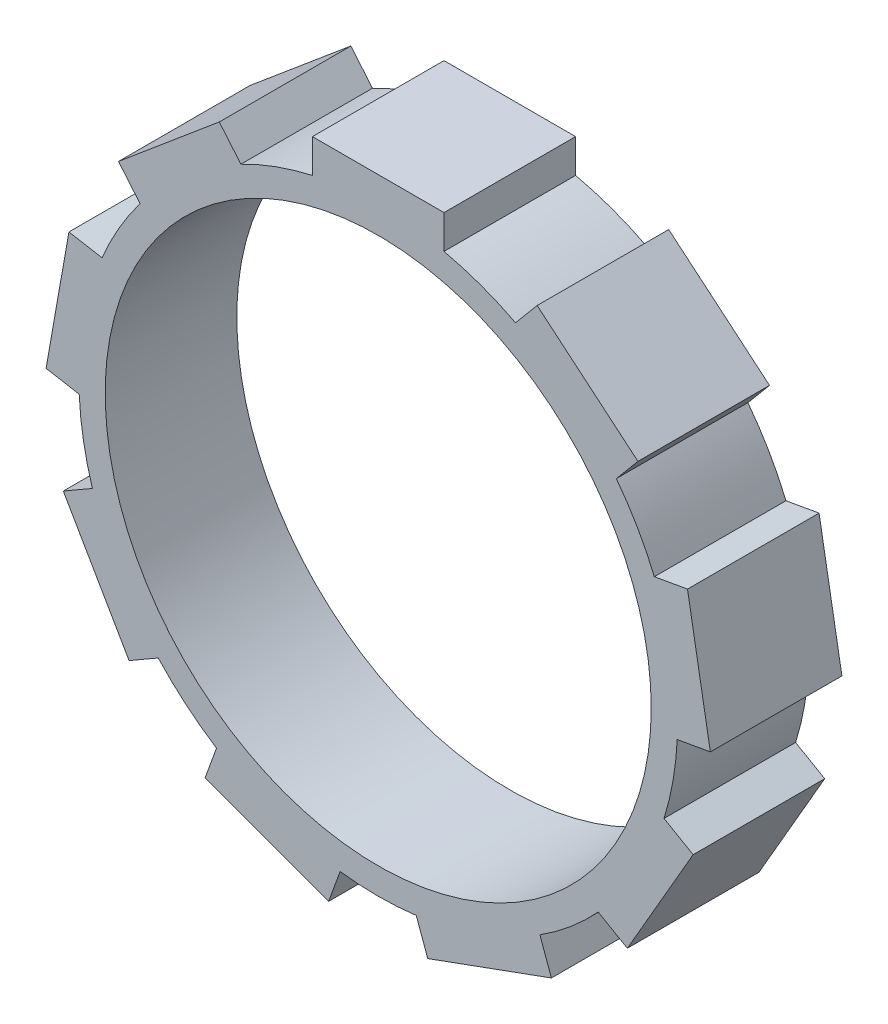
from build123d import *

# Parameters (mm, degrees)
CROQUIS1_R              = 20.75
SALIENTE_EXTRUIR1_DEPTH = 10


with BuildPart() as part:
    # Croquis1 → Saliente-Extruir1 (new body)
    with BuildSketch(Plane.XY):
        with BuildLine():
            Line((19.739215555, 15.745661919), (12.078771124, 22.173538016))
            Line((12.078771124, 22.173538016), (10.435644731, 20.215336234))
            ThreePointArc((10.435644731, 20.215336234), (7.780958261, 21.378007123), (5, 22.19374912))
            Line((5, 22.19374912), (5, 24.75))
            Line((5, 24.75), (-5, 24.75))
            Line((-5, 24.75), (-5, 22.19374912))
            ThreePointArc((-5, 22.19374912), (-7.780958261, 21.378007123), (-10.435644731, 20.215336234))
            Line((-10.435644731, 20.215336234), (-12.078771124, 22.173538016))
            Line((-12.078771124, 22.173538016), (-19.739215555, 15.745661919))
            Line((-19.739215555, 15.745661919), (-18.096089162, 13.787460137))
            ThreePointArc((-18.096089162, 13.787460137), (-19.702077936, 11.375), (-20.988335313, 8.777942855))
            Line((-20.988335313, 8.777942855), (-23.505750999, 9.221831162))
            Line((-23.505750999, 9.221831162), (-25.242232775, -0.626246368))
            Line((-25.242232775, -0.626246368), (-22.72481709, -1.070134675))
            ThreePointArc((-22.72481709, -1.070134675), (-22.404376381, -3.950496042), (-21.720350543, -6.766747541))
            Line((-21.720350543, -6.766747541), (-23.934128744, -8.044872981))
            Line((-23.934128744, -8.044872981), (-18.934128744, -16.705127019))
            Line((-18.934128744, -16.705127019), (-16.720350543, -15.427001579))
            ThreePointArc((-16.720350543, -15.427001579), (-14.62341812, -17.427511081), (-12.289172359, -19.145201559))
            Line((-12.289172359, -19.145201559), (-13.163461651, -21.547291648))
            Line((-13.163461651, -21.547291648), (-3.766535443, -24.967493081))
            Line((-3.766535443, -24.967493081), (-2.892246151, -22.565402992))
            ThreePointArc((-2.892246151, -22.565402992), (0, -22.75), (2.892246151, -22.565402992))
            Line((2.892246151, -22.565402992), (3.766535443, -24.967493081))
            Line((3.766535443, -24.967493081), (13.163461651, -21.547291648))
            Line((13.163461651, -21.547291648), (12.289172359, -19.145201559))
            ThreePointArc((12.289172359, -19.145201559), (14.62341812, -17.427511081), (16.720350543, -15.427001579))
            Line((16.720350543, -15.427001579), (18.934128744, -16.705127019))
            Line((18.934128744, -16.705127019), (23.934128744, -8.044872981))
            Line((23.934128744, -8.044872981), (21.720350543, -6.766747541))
            ThreePointArc((21.720350543, -6.766747541), (22.404376381, -3.950496042), (22.72481709, -1.070134675))
            Line((22.72481709, -1.070134675), (25.242232775, -0.626246368))
            Line((25.242232775, -0.626246368), (23.505750999, 9.221831162))
            Line((23.505750999, 9.221831162), (20.988335313, 8.777942855))
            ThreePointArc((20.988335313, 8.777942855), (19.702077936, 11.375), (18.096089162, 13.787460137))
            Line((18.096089162, 13.787460137), (19.739215555, 15.745661919))
        make_face()
        Circle(CROQUIS1_R, mode=Mode.SUBTRACT)
    extrude(amount=SALIENTE_EXTRUIR1_DEPTH)


solid = part.part
